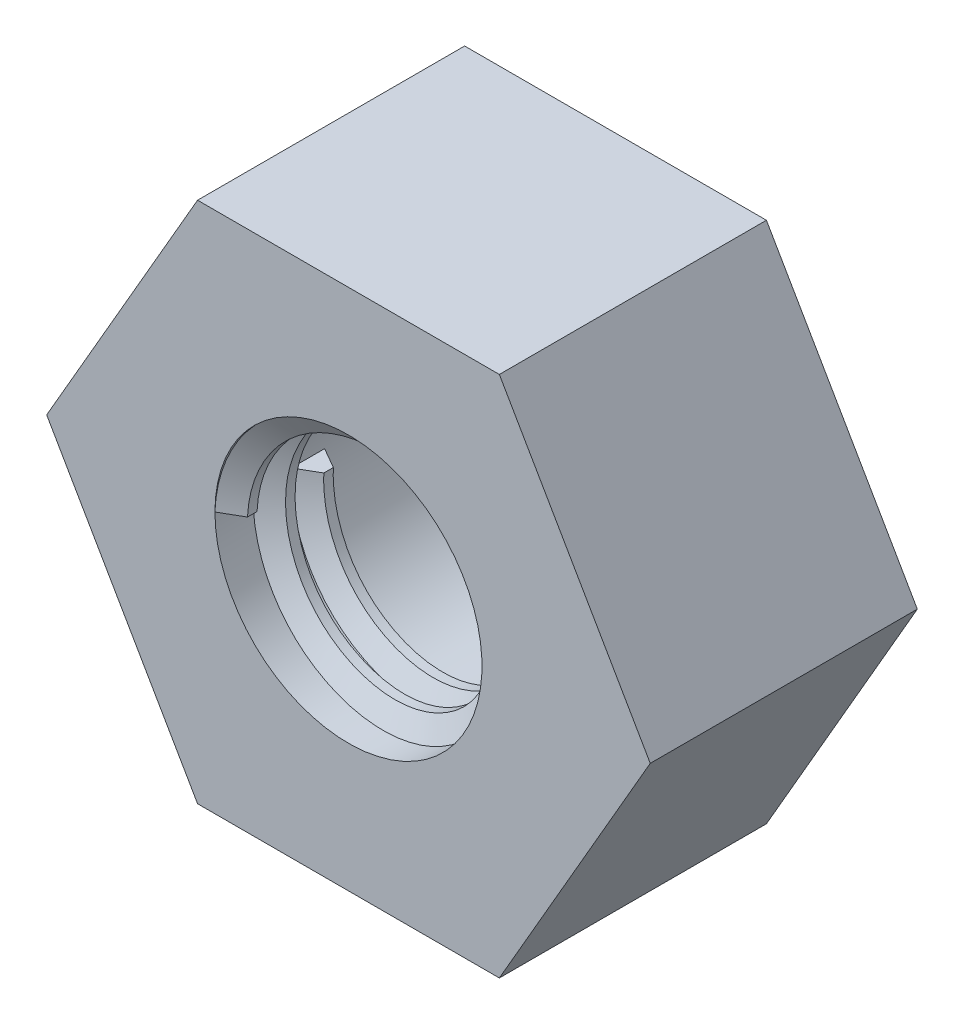
from build123d import *

# Parameters (mm, degrees)
SKETCH1_R           = 1.75
BOSS_EXTRUDE1_DEPTH = 3.5
THREAD1_PITCH       = 0.5


with BuildPart() as part:
    # Sketch1 → Boss-Extrude1 (new body)
    with BuildSketch(Plane.XY):
        Polygon((3.954849344, 0), (1.977424672, 3.425), (-1.977424672, 3.425), (-3.954849344, 0), (-1.977424672, -3.425), (1.977424672, -3.425), align=None)
        Circle(SKETCH1_R, mode=Mode.SUBTRACT)
    extrude(amount=BOSS_EXTRUDE1_DEPTH)

    # Thread1: the profile of Thread Profile1 profile screwed along a right-hand helix of 2 turns, 6 arcs to a turn; built about Z, then put on its axis
    thread1_z = Axis((0, 0, 0), (0, 0, 1))
    thread1_corners = [(1.7503, 0, -0.000173205), (1.7503, 0, 0.437673204), (1.479367063, 0, 0.281249999), (1.479367062, 0, 0.156249999)]
    with BuildLine(mode=Mode.PRIVATE) as thread1_profile:
        Line(thread1_corners[0], thread1_corners[1])
        Line(thread1_corners[1], thread1_corners[2])
        Line(thread1_corners[2], thread1_corners[3])
        Line(thread1_corners[3], thread1_corners[0])
    thread1_cap = Face(thread1_profile.wire())
    thread1_turn_angles = [0, 30, 60, 90, 120, 150, 180, 210, 240, 270, 300, 330, 360]
    thread1_turn_weights = [1, 0.8660254037844387, 1, 0.8660254037844387, 1, 0.8660254037844387, 1, 0.8660254037844387, 1, 0.8660254037844387, 1, 0.8660254037844387, 1]
    thread1_turn_rails = [Edge.make_bspline([Vector(p[0], p[1], 0).rotate(thread1_z, thread1_turn_angles[k]) / thread1_turn_weights[k] + Vector(0, 0, p[2] + THREAD1_PITCH * thread1_turn_angles[k] / 360) for k in range(13)], [0, 0, 0, 1, 1, 2, 2, 3, 3, 4, 4, 5, 5, 6, 6, 6], 2, thread1_turn_weights) for p in thread1_corners]
    thread1_turn_sides = [Face.make_surface_from_curves(thread1_turn_rails[p[0]], thread1_turn_rails[p[1]]) for p in [(0, 1), (1, 2), (2, 3), (3, 0)]]
    thread1 = Plane(origin=(0, 0, 3.5), x_dir=(-1, 0, 0), z_dir=(0, 0, -1)) * Solid(Shell([*[p.moved(Location((0, 0, THREAD1_PITCH * i))) for i in range(2) for p in thread1_turn_sides], thread1_cap, thread1_cap.rotate(thread1_z, 720).moved(Location((0, 0, THREAD1_PITCH * 720 / 360)))]))
    add(thread1)


solid = part.part
